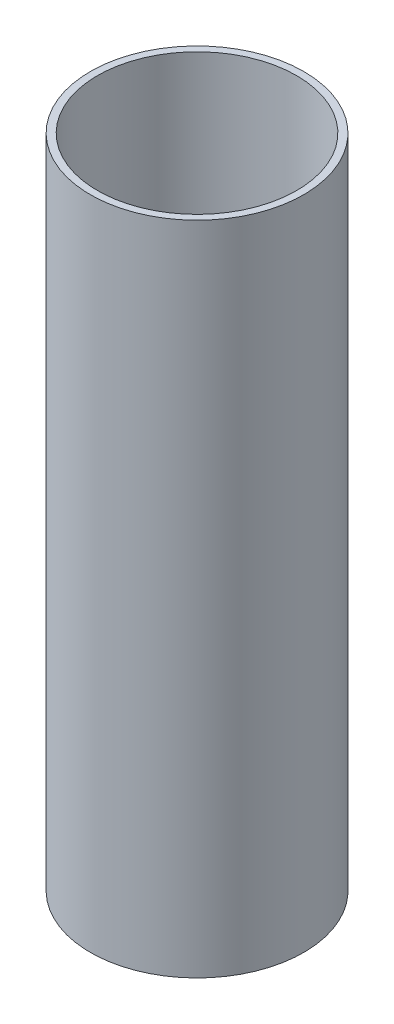
from build123d import *

# Parameters (mm, degrees)
SKETCH1_W = 1.9304
SKETCH1_H = 177.8


with BuildPart() as part:
    # Sketch1 → Revolve1 (revolve)
    with BuildSketch(Plane.XY):
        with Locations((27.9527, -63.711391886)):
            Rectangle(SKETCH1_W, SKETCH1_H)
    revolve(axis=Axis((0, 0, 0), (0, 1, 0)))


solid = part.part
